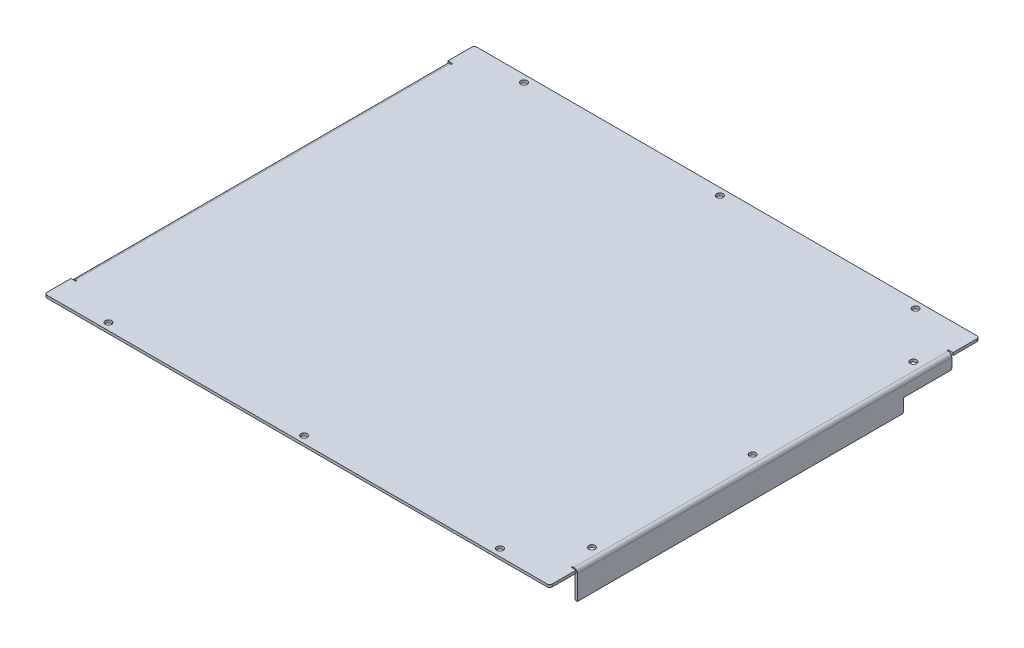
from build123d import *

# Parameters (mm, degrees)
SKETCH1_W                       = 391.4
SKETCH1_H                       = 333
BASE_FLANGE1_DEPTH              = 2
EDGE_FLANGE1_STRIP_W            = 9.4732
EDGE_FLANGE1_STRIP_H            = 2
EDGE_FLANGE1_STRIP_CUT_DEPTH    = 290
EDGE_FLANGE1_RELIEF_W           = 10.4732
EDGE_FLANGE1_RELIEF_H           = 1
EDGE_FLANGE1_RELIEF_CUT_DEPTH   = 2
EDGE_FLANGE1_STRIP_2_W          = 9.4732
EDGE_FLANGE1_STRIP_2_H          = 2
EDGE_FLANGE1_STRIP_CUT_2_DEPTH  = 290
EDGE_FLANGE1_RELIEF_2_W         = 10.4732
EDGE_FLANGE1_RELIEF_2_H         = 1
EDGE_FLANGE1_RELIEF_CUT_2_DEPTH = 2
EDGE_FLANGE1_DEPTH              = 290
EDGE_FLANGE1_BEND_DEPTH         = 290
FILLET1_R                       = 2
CUT_EXTRUDE1_DEPTH              = 10
FILLET2_R                       = 1
CUT_EXTRUDE2_DEPTH              = 258.84295608
CUT_EXTRUDE2_DEPTH_BACK         = 258.84295608
SKETCH9_R                       = 2.5


# Sheet-metal steps are written as plain solids
with BuildPart() as part:
    # Sketch1 → Base-Flange1 (new body)
    with BuildSketch(Plane(origin=(0, 0, 0), x_dir=(1, 0, 0), z_dir=(0, 1, 0))):
        Rectangle(SKETCH1_W, SKETCH1_H)
    extrude(amount=BASE_FLANGE1_DEPTH)

    # Edge-Flange1 strip (across the edge) → Edge-Flange1 strip cut (cut)
    with BuildSketch(Plane(origin=(-195.7, 0, 145), x_dir=(1, 0, 0), z_dir=(0, 0, -1))):
        with Locations((-2, -1)):
            Rectangle(EDGE_FLANGE1_STRIP_W, EDGE_FLANGE1_STRIP_H)
    extrude(amount=EDGE_FLANGE1_STRIP_CUT_DEPTH, mode=Mode.SUBTRACT)

    # Edge-Flange1 relief (on the sheet) → Edge-Flange1 relief cut (cut)
    with BuildSketch(Plane(origin=(-192.9634, 0, 145), x_dir=(1, 0, 0), z_dir=(0, -1, 0))):
        with Locations((-4.2366, 0.5)):
            Rectangle(EDGE_FLANGE1_RELIEF_W, EDGE_FLANGE1_RELIEF_H)
        with Locations((-4.2366, -290.5)):
            Rectangle(EDGE_FLANGE1_RELIEF_W, EDGE_FLANGE1_RELIEF_H)
    extrude(amount=-EDGE_FLANGE1_RELIEF_CUT_DEPTH, mode=Mode.SUBTRACT)

    # Edge-Flange1 strip 2 (across the edge) → Edge-Flange1 strip cut 2 (cut)
    with BuildSketch(Plane(origin=(195.7, 0, -145), x_dir=(-1, 0, 0), z_dir=(0, 0, 1))):
        with Locations((-2, -1)):
            Rectangle(EDGE_FLANGE1_STRIP_2_W, EDGE_FLANGE1_STRIP_2_H)
    extrude(amount=EDGE_FLANGE1_STRIP_CUT_2_DEPTH, mode=Mode.SUBTRACT)

    # Edge-Flange1 relief 2 (on the sheet) → Edge-Flange1 relief cut 2 (cut)
    with BuildSketch(Plane(origin=(192.9634, 0, -145), x_dir=(-1, 0, 0), z_dir=(0, -1, 0))):
        with Locations((-4.2366, 0.5)):
            Rectangle(EDGE_FLANGE1_RELIEF_2_W, EDGE_FLANGE1_RELIEF_2_H)
        with Locations((-4.2366, -290.5)):
            Rectangle(EDGE_FLANGE1_RELIEF_2_W, EDGE_FLANGE1_RELIEF_2_H)
    extrude(amount=-EDGE_FLANGE1_RELIEF_CUT_2_DEPTH, mode=Mode.SUBTRACT)

    # Edge-Flange1 section (across the edge) → Edge-Flange1 (add)
    with BuildSketch(Plane(origin=(-195.7, 0, 145), x_dir=(1, 0, 0), z_dir=(0, 0, -1))):
        with BuildLine():
            Line((0, 0.7366), (0, 19.5))
            Line((0, 19.5), (2, 19.5))
            Line((2, 19.5), (2, 0.7366))
            ThreePointArc((2, 0.7366), (2.215745145, 0.215745145), (2.7366, 0))
            Line((2.7366, 0), (2.7366, -2))
            ThreePointArc((2.7366, -2), (0.801531583, -1.198468417), (0, 0.7366))
        make_face()
    extrude(amount=EDGE_FLANGE1_DEPTH)

    # Edge-Flange1 section 2 (across the edge) → Edge-Flange1 bend (add)
    with BuildSketch(Plane(origin=(195.7, 0, -145), x_dir=(-1, 0, 0), z_dir=(0, 0, 1))):
        with BuildLine():
            Line((0, 0.7366), (0, 19.5))
            Line((0, 19.5), (2, 19.5))
            Line((2, 19.5), (2, 0.7366))
            ThreePointArc((2, 0.7366), (2.215745145, 0.215745145), (2.7366, 0))
            Line((2.7366, 0), (2.7366, -2))
            ThreePointArc((2.7366, -2), (0.801531583, -1.198468417), (0, 0.7366))
        make_face()
    extrude(amount=EDGE_FLANGE1_BEND_DEPTH)

    # Fillet1
    fillet1_edges = [part.edges().sort_by_distance(p)[0] for p in [
        (195.7, 1, 166.5),
        (-195.7, 1, 166.5),
        (-195.7, 1, -166.5),
        (195.7, 1, -166.5),
    ]]
    fillet(fillet1_edges, radius=FILLET1_R)

    # Sketch8 → Cut-Extrude1 (cut)
    with BuildSketch(Plane(origin=(195.7, 0, 0), x_dir=(0, 0, -1), z_dir=(1, 0, 0))):
        with BuildLine():
            Line((107.5, -19.5), (147.855530229, -19.5))
            Line((147.855530229, -19.5), (147.855530229, -9))
            Line((147.855530229, -9), (108.5, -9))
            ThreePointArc((108.5, -9), (107.792893219, -9.292893219), (107.5, -10))
            Line((107.5, -10), (107.5, -19.5))
        make_face()
    extrude(amount=-CUT_EXTRUDE1_DEPTH, mode=Mode.SUBTRACT)

    # Fillet2
    fillet2_edges = [part.edges().sort_by_distance(p)[0] for p in [
        (194.7, -19.5, -107.5),
        (194.7, -9, -145),
    ]]
    fillet(fillet2_edges, radius=FILLET2_R)

    # Sketch9 → Cut-Extrude2 (cut, two sides: drawn at the far end of the back side and taken through both)
    with BuildSketch(Plane(origin=(0, 2, 0), x_dir=(1, 0, 0), z_dir=(0, 1, 0)).offset(-CUT_EXTRUDE2_DEPTH_BACK)):
        with Locations(Location((-151.7, -161, 0), (0, 0, 270))):
            Circle(SKETCH9_R)
        with Locations(Location((0, -161, 0), (0, 0, 270))):
            Circle(SKETCH9_R)
        with Locations(Location((151.7, -161, 0), (0, 0, 270))):
            Circle(SKETCH9_R)
        with Locations(Location((186.4634, -124.5, 0), (0, 0, 270))):
            Circle(SKETCH9_R)
        with Locations(Location((186.4634, 0, 0), (0, 0, 270))):
            Circle(SKETCH9_R)
        with Locations(Location((186.4634, 124.5, 0), (0, 0, 270))):
            Circle(SKETCH9_R)
        with Locations(Location((151.7, 161, 0), (0, 0, 270))):
            Circle(SKETCH9_R)
        with Locations(Location((0, 161, 0), (0, 0, 270))):
            Circle(SKETCH9_R)
        with Locations(Location((-151.7, 161, 0), (0, 0, 270))):
            Circle(SKETCH9_R)
    extrude(amount=CUT_EXTRUDE2_DEPTH + CUT_EXTRUDE2_DEPTH_BACK, mode=Mode.SUBTRACT)


solid = part.part
